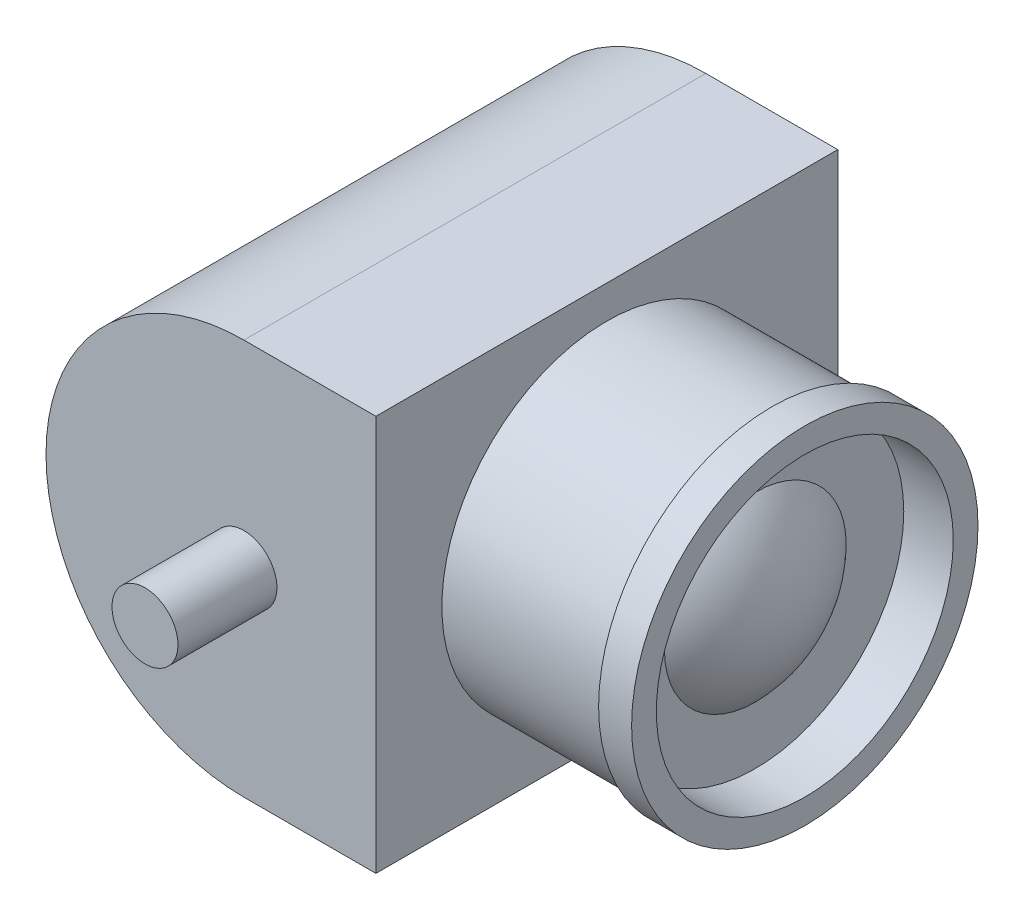
from build123d import *

# Parameters (mm, degrees)
SKETCH1_W           = 14
SKETCH1_H           = 12
BOSS_EXTRUDE1_DEPTH = 10
SKETCH2_R           = 5
BOSS_EXTRUDE2_DEPTH = 5
SKETCH3_R           = 5.25
BOSS_EXTRUDE3_DEPTH = 1
SKETCH5_R           = 4.5
CUT_EXTRUDE1_DEPTH  = 1.5
FILLET1_R           = 6
SKETCH11_R          = 1
BOSS_EXTRUDE4_DEPTH = 10


with BuildPart() as part:
    # Sketch1 → Boss-Extrude1 (new body)
    with BuildSketch(Plane(origin=(0, 0, 0), x_dir=(0, 0, -1), z_dir=(1, 0, 0))):
        Rectangle(SKETCH1_W, SKETCH1_H)
    extrude(amount=BOSS_EXTRUDE1_DEPTH)

    # Sketch2 → Boss-Extrude2 (add)
    with BuildSketch(Plane(origin=(10, 0, 0), x_dir=(0, 0, -1), z_dir=(1, 0, 0))):
        Circle(SKETCH2_R)
    extrude(amount=BOSS_EXTRUDE2_DEPTH)

    # Sketch3 → Boss-Extrude3 (add)
    with BuildSketch(Plane(origin=(15, 0, 0), x_dir=(0, 0, -1), z_dir=(1, 0, 0))):
        Circle(SKETCH3_R)
    extrude(amount=BOSS_EXTRUDE3_DEPTH)

    # Sketch5 → Cut-Extrude1 (cut)
    with BuildSketch(Plane(origin=(16, 0, 0), x_dir=(0, 0, -1), z_dir=(1, 0, 0))):
        Circle(SKETCH5_R)
    extrude(amount=-CUT_EXTRUDE1_DEPTH, mode=Mode.SUBTRACT)

    # Sketch6 → Revolve2 (revolve)
    with BuildSketch(Plane(origin=(0, 0, 0), x_dir=(1, 0, 0), z_dir=(0, 1, 0)), mode=Mode.PRIVATE) as revolve2_sk:
        with BuildLine():
            Line((11.6, 0), (15.6, 0))
            ThreePointArc((15.6, 0), (14.428427125, 2.828427125), (11.6, 4))
            Line((11.6, 4), (11.6, 0))
        make_face()
    revolve(revolve2_sk.sketch.rotate(Axis((11.6, 0, 0), (1, 0, 0)), 180), axis=Axis((11.6, 0, 0), (1, 0, 0)))

    # Fillet1
    fillet1_edges = [part.edges().sort_by_distance(p)[0] for p in [
        (0, -6, 0),
        (0, 6, 0),
    ]]
    fillet(fillet1_edges, radius=FILLET1_R - 0.0001)  # a hair under: the kernel refuses the full size

    # Sketch11 → Boss-Extrude4 (add, symmetric)
    with BuildSketch(Plane.XY):
        with Locations(Location((6, 0, 0), (0, 0, 90))):
            Circle(SKETCH11_R)
    extrude(amount=BOSS_EXTRUDE4_DEPTH, both=True)


solid = part.part
